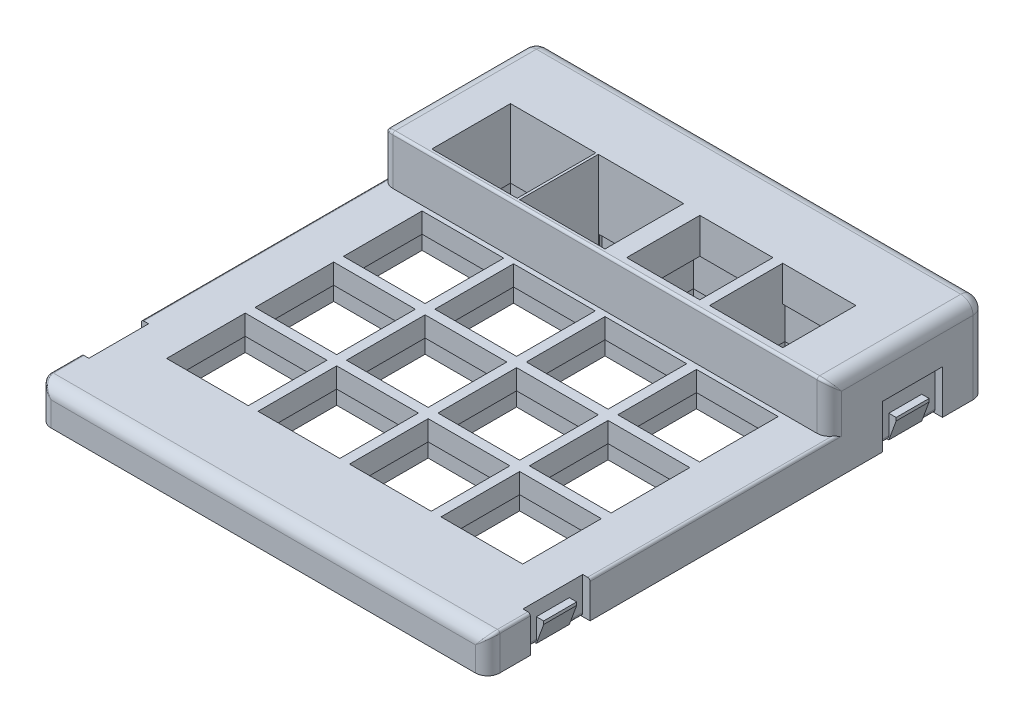
from build123d import *

# Parameters (mm, degrees)
SKIZZE2_W                       = 73.6
SKIZZE2_H                       = 81.6
AUFSATZ_LINEAR_AUSTRAGEN1_DEPTH = 6
SKIZZE3_W                       = 13.4
SKIZZE3_H                       = 12.9
SCHNITT_LINEAR_AUSTRAGEN1_DEPTH = 108.5140921
LINEARES_MUSTER1_COUNT          = 4
LINEARES_MUSTER1_PITCH          = 14.5
LINEARES_MUSTER1_COUNT_DIR2     = 4
LINEARES_MUSTER1_PITCH_DIR2     = 15
SKIZZE4_W                       = 14.2
SKIZZE4_H                       = 13.7
SCHNITT_LINEAR_AUSTRAGEN2_DEPTH = 2.7
LINEARES_MUSTER2_COUNT          = 4
LINEARES_MUSTER2_PITCH          = 14.5
LINEARES_MUSTER2_COUNT_DIR2     = 4
LINEARES_MUSTER2_PITCH_DIR2     = 15
SCHNITT_LINEAR_AUSTRAGEN6_DEPTH = 1.2
VERRUNDUNG1_R                   = 0.6
FASE1_SIZE                      = 1.2
FASE1_SIZE2                     = 3.296972903
SKIZZE7_W                       = 73.6
SKIZZE7_H                       = 25.55
SKIZZE7_W_2                     = 14
SKIZZE7_H_2                     = 12.9
SKIZZE7_W_3                     = 12
SKIZZE7_H_3                     = 12
AUFSATZ_LINEAR_AUSTRAGEN2_DEPTH = 8
SKIZZE8_W                       = 14
SKIZZE8_H                       = 12.9
SCHNITT_LINEAR_AUSTRAGEN8_DEPTH = 8
FASE2_SIZE                      = 1.2
SKIZZE9_W                       = 13.4
SKIZZE9_H                       = 12.9
SCHNITT_LINEAR_AUSTRAGEN9_DEPTH = 2.2
VERRUNDUNG2_R                   = 2
VERRUNDUNG3_R                   = 0.4


with BuildPart() as part:
    # Skizze2 → Aufsatz-Linear austragen1 (new body)
    with BuildSketch(Plane(origin=(0, 1.2, 0), x_dir=(1, 0, 0), z_dir=(0, 1, 0))):
        with Locations((35, 39)):
            Rectangle(SKIZZE2_W, SKIZZE2_H)
    extrude(amount=AUFSATZ_LINEAR_AUSTRAGEN1_DEPTH)

    # Skizze3 → Schnitt-Linear austragen1 (cut, through all)
    with BuildSketch(Plane(origin=(0, 1.2, 0), x_dir=(1, 0, 0), z_dir=(0, 1, 0))):
        with Locations((12.5, 18)):
            Rectangle(SKIZZE3_W, SKIZZE3_H)
    schnitt_linear_austragen1 = extrude(amount=SCHNITT_LINEAR_AUSTRAGEN1_DEPTH, mode=Mode.SUBTRACT)

    # Lineares Muster1: Schnitt-Linear austragen1 4 × 4
    with Locations(*[(j * LINEARES_MUSTER1_PITCH_DIR2, 0, -i * LINEARES_MUSTER1_PITCH) for i in range(LINEARES_MUSTER1_COUNT) for j in range(LINEARES_MUSTER1_COUNT_DIR2) if (i, j) != (0, 0)]):
        add(schnitt_linear_austragen1, mode=Mode.SUBTRACT)

    # Skizze4 → Schnitt-Linear austragen2 (cut)
    with BuildSketch(Plane(origin=(0, 1.2, 0), x_dir=(1, 0, 0), z_dir=(0, 1, 0))):
        with Locations((12.5, 18)):
            Rectangle(SKIZZE4_W, SKIZZE4_H)
    schnitt_linear_austragen2 = extrude(amount=SCHNITT_LINEAR_AUSTRAGEN2_DEPTH, mode=Mode.SUBTRACT)

    # Lineares Muster2: Schnitt-Linear austragen2 4 × 4
    with Locations(*[(j * LINEARES_MUSTER2_PITCH_DIR2, 0, -i * LINEARES_MUSTER2_PITCH) for i in range(LINEARES_MUSTER2_COUNT) for j in range(LINEARES_MUSTER2_COUNT_DIR2) if (i, j) != (0, 0)]):
        add(schnitt_linear_austragen2, mode=Mode.SUBTRACT)

    # Skizze6 → Schnitt-Linear austragen6 (cut)
    with BuildSketch(Plane(origin=(-1.8, 0, 0), x_dir=(0, 0, -1), z_dir=(1, 0, 0))):
        Polygon((72.8, 7.2), (63, 7.2), (63, 1.2), (65.2, 1.2), (65.2, 5), (70.6, 5), (70.6, 1.2), (72.8, 1.2), align=None)
        Polygon((5.2, 7.2), (15, 7.2), (15, 1.2), (12.8, 1.2), (12.8, 5), (7.4, 5), (7.4, 1.2), (5.2, 1.2), align=None)
    schnitt_linear_austragen6 = extrude(amount=SCHNITT_LINEAR_AUSTRAGEN6_DEPTH, mode=Mode.SUBTRACT)

    # Spiegeln1: Schnitt-Linear austragen6 across plane
    add(schnitt_linear_austragen6.mirror(Plane(origin=(35, 0, 0), x_dir=(0, 0, 1), z_dir=(1, 0, 0))), mode=Mode.SUBTRACT)

    # Verrundung1
    verrundung1_edges = [part.edges().sort_by_distance(p)[0] for p in [
        (-0.6, 1.2, -64.1),
        (-0.6, 1.2, -71.7),
        (-0.6, 1.2, -6.3),
        (-0.6, 1.2, -13.9),
        (70.6, 1.2, -71.7),
        (70.6, 1.2, -64.1),
        (70.6, 1.2, -13.9),
        (70.6, 1.2, -6.3),
    ]]
    fillet(verrundung1_edges, radius=VERRUNDUNG1_R)

    # Fase1
    fase1_edges = [part.edges().sort_by_distance(p)[0] for p in [
        (-1.8, 1.2, -67.9),
        (-1.8, 1.2, -10.1),
        (71.8, 1.2, -10.1),
        (71.8, 1.2, -67.9),
    ]]
    fase1_side = [part.faces().sort_by_distance(p)[0] for p in [
        (35, 1.2, -38.184159025),
    ]]
    chamfer(fase1_edges, length=FASE1_SIZE, length2=FASE1_SIZE2, reference=fase1_side[0])

    # Skizze7 → Aufsatz-Linear austragen2 (add)
    with BuildSketch(Plane(origin=(0, 7.2, 0), x_dir=(1, 0, 0), z_dir=(0, 1, 0))):
        with Locations((35, 67.025)):
            Rectangle(SKIZZE7_W, SKIZZE7_H)
        with Locations((27.2, 61.5)):
            Rectangle(SKIZZE7_W_2, SKIZZE7_H_2, mode=Mode.SUBTRACT)
        with Locations((12.8, 61.5)):
            Rectangle(SKIZZE7_W_2, SKIZZE7_H_2, mode=Mode.SUBTRACT)
        with Locations((43.2, 61.6)):
            Rectangle(SKIZZE7_W_3, SKIZZE7_H_3, mode=Mode.SUBTRACT)
        with Locations((56.8, 61.6)):
            Rectangle(SKIZZE7_W_3, SKIZZE7_H_3, mode=Mode.SUBTRACT)
    extrude(amount=AUFSATZ_LINEAR_AUSTRAGEN2_DEPTH)

    # Skizze8 → Schnitt-Linear austragen8 (cut)
    with BuildSketch(Plane(origin=(0, 7.2, 0), x_dir=(1, 0, 0), z_dir=(0, 1, 0))):
        with Locations((12.8, 61.5)):
            Rectangle(SKIZZE8_W, SKIZZE8_H)
        with Locations((27.2, 61.5)):
            Rectangle(SKIZZE8_W, SKIZZE8_H)
    extrude(amount=-SCHNITT_LINEAR_AUSTRAGEN8_DEPTH, mode=Mode.SUBTRACT)

    # Fase2
    fase2_edges = [part.edges().sort_by_distance(p)[0] for p in [
        (-1.8, 7.2, -67.9),
        (71.8, 7.2, -67.9),
    ]]
    chamfer(fase2_edges, length=FASE2_SIZE - 0.0001)  # a hair under: the kernel refuses the full size

    # Skizze9 → Schnitt-Linear austragen9 (cut)
    with BuildSketch(Plane(origin=(0, 7.2, 0), x_dir=(1, 0, 0), z_dir=(0, 1, 0))):
        with Locations((57.5, 61.5)):
            Rectangle(SKIZZE9_W, SKIZZE9_H)
        with Locations((42.5, 61.5)):
            Rectangle(SKIZZE9_W, SKIZZE9_H)
    extrude(amount=SCHNITT_LINEAR_AUSTRAGEN9_DEPTH, mode=Mode.SUBTRACT)

    # Verrundung2
    verrundung2_edges = [part.edges().sort_by_distance(p)[0] for p in [
        (35, 7.2, 1.8),
        (-1.8, 8.2, -79.8),
        (71.8, 8.2, -79.8),
        (71.8, 4.2, 1.8),
        (-1.8, 4.2, 1.8),
        (-1.8, 15.2, -67.025),
        (71.8, 15.2, -67.025),
        (35, 15.2, -79.8),
        (-1.8, 11.2, -54.25),
        (71.8, 11.2, -54.25),
    ]]
    fillet(verrundung2_edges, radius=VERRUNDUNG2_R)

    # Verrundung3
    verrundung3_edges = [part.edges().sort_by_distance(p)[0] for p in [
        (35, 15.2, -54.25),
        (71.8, 7.2, -2.7),
        (71.326592034, 14.492097815, -54.957902185),
        (-1.326591872, 14.492098006, -54.957901994),
        (-1.092097815, 6.492097815, 1.326592034),
        (71.092097815, 6.492097815, 1.326592034),
        (-1.8, 7.2, -2.7),
        (71.8, 7.2, -35.625),
        (-1.8, 7.2, -35.625),
    ]]
    fillet(verrundung3_edges, radius=VERRUNDUNG3_R)


solid = part.part
